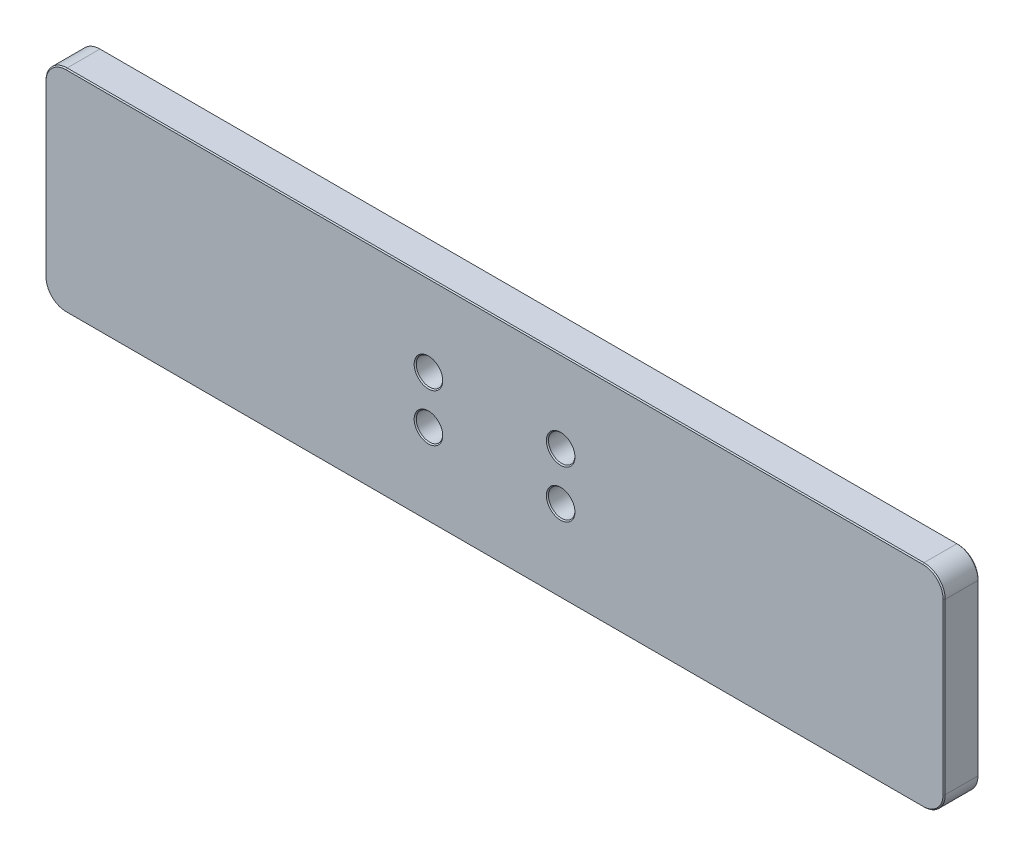
from build123d import *

# Parameters (mm, degrees)
SKETCH1_W           = 215.9
SKETCH1_H           = 50.8
SKETCH1_R           = 3.175
BOSS_EXTRUDE1_DEPTH = 8.382
FILLET1_R           = 5.08
CHAMFER1_SIZE       = 0.254


with BuildPart() as part:
    # Sketch1 → Boss-Extrude1 (new body)
    with BuildSketch(Plane.XY):
        Rectangle(SKETCH1_W, SKETCH1_H)
        with Locations((-15.875, 5.715)):
            Circle(SKETCH1_R, mode=Mode.SUBTRACT)
        with Locations((15.875, 5.715)):
            Circle(SKETCH1_R, mode=Mode.SUBTRACT)
        with Locations((15.875, -5.715)):
            Circle(SKETCH1_R, mode=Mode.SUBTRACT)
        with Locations((-15.875, -5.715)):
            Circle(SKETCH1_R, mode=Mode.SUBTRACT)
    extrude(amount=BOSS_EXTRUDE1_DEPTH)

    # Fillet1
    fillet1_edges = [part.edges().sort_by_distance(p)[0] for p in [
        (-107.95, -25.4, 4.191),
        (107.95, -25.4, 4.191),
        (107.95, 25.4, 4.191),
        (-107.95, 25.4, 4.191),
    ]]
    fillet(fillet1_edges, radius=FILLET1_R)

    # Chamfer1
    chamfer1_edges = [part.edges().sort_by_distance(p)[0] for p in [
        (-19.05, -5.715, 0),
        (12.7, -5.715, 0),
        (12.7, 5.715, 0),
        (-19.05, 5.715, 0),
        (106.462102448, -23.912102448, 0),
        (107.95, 0, 0),
        (106.462102448, 23.912102448, 0),
        (0, 25.4, 0),
        (-106.462102448, 23.912102448, 0),
        (-107.95, 0, 0),
        (-106.462102448, -23.912102448, 0),
        (0, -25.4, 0),
        (-19.05, -5.715, 8.382),
        (12.7, 5.715, 8.382),
        (-106.462102448, 23.912102448, 8.382),
        (0, 25.4, 8.382),
        (106.462102448, 23.912102448, 8.382),
        (107.95, 0, 8.382),
        (106.462102448, -23.912102448, 8.382),
        (0, -25.4, 8.382),
        (-106.462102448, -23.912102448, 8.382),
        (-107.95, 0, 8.382),
        (-19.05, 5.715, 8.382),
        (12.7, -5.715, 8.382),
    ]]
    chamfer(chamfer1_edges, length=CHAMFER1_SIZE)


solid = part.part
